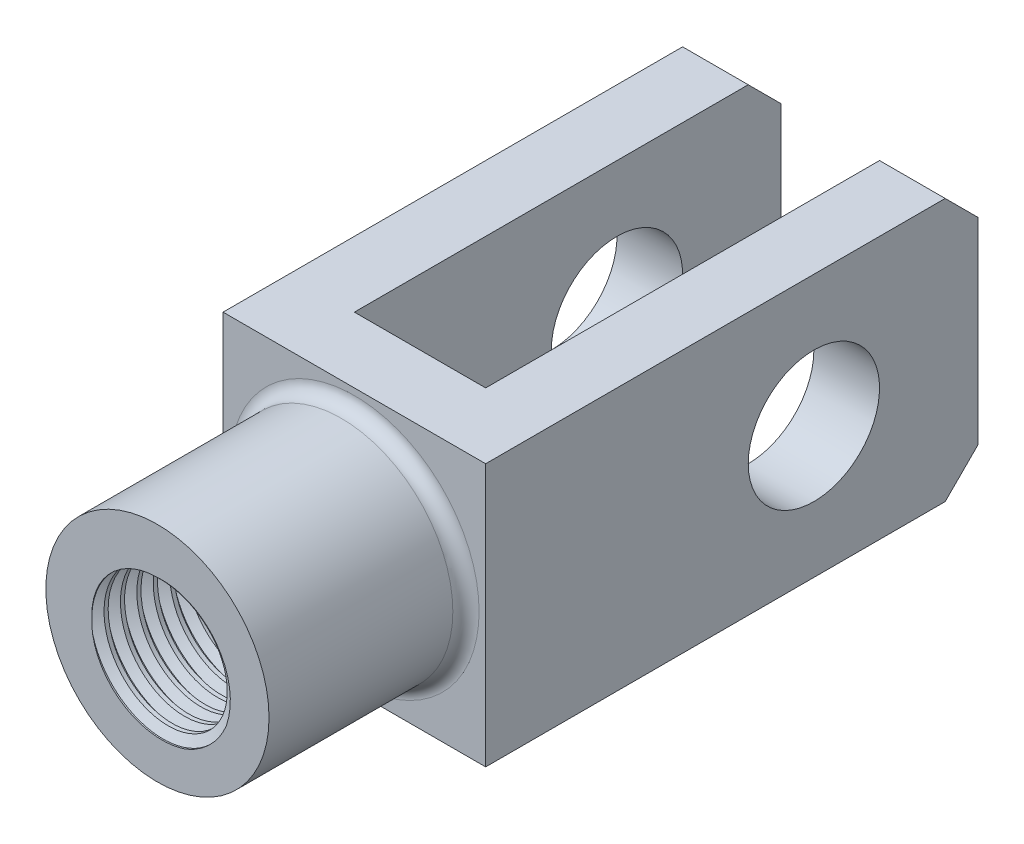
from build123d import *

# Parameters (mm, degrees)
SKETCH1_R           = 17
BOSS_EXTRUDE1_DEPTH = 30
SKETCH2_W           = 40
SKETCH2_H           = 40
BOSS_EXTRUDE2_DEPTH = 75
SKETCH3_W           = 20
SKETCH3_H           = 65
CUT_EXTRUDE1_DEPTH  = 75
CHAMFER1_SIZE       = 5
SKETCH4_R           = 10
CUT_EXTRUDE2_DEPTH  = 88.321245983
FILLET1_R           = 2
SKETCH7_R           = 10
CUT_EXTRUDE3_DEPTH  = 23
THREAD1_PITCH       = 2.5
THREAD1_TO          = 25.5


with BuildPart() as part:
    # Sketch1 → Boss-Extrude1 (new body)
    with BuildSketch(Plane.XY):
        Circle(SKETCH1_R)
    extrude(amount=BOSS_EXTRUDE1_DEPTH)

    # Sketch2 → Boss-Extrude2 (add)
    with BuildSketch(Plane(origin=(0, 0, 0), x_dir=(-1, 0, 0), z_dir=(0, 0, -1))):
        Rectangle(SKETCH2_W, SKETCH2_H)
    extrude(amount=BOSS_EXTRUDE2_DEPTH)

    # Sketch3 → Cut-Extrude1 (cut)
    with BuildSketch(Plane(origin=(0, 20, 0), x_dir=(1, 0, 0), z_dir=(0, 1, 0))):
        with Locations((0, 42.5)):
            Rectangle(SKETCH3_W, SKETCH3_H)
    extrude(amount=-CUT_EXTRUDE1_DEPTH, mode=Mode.SUBTRACT)

    # Chamfer1
    chamfer1_edges = [part.edges().sort_by_distance(p)[0] for p in [
        (15, 20, -75),
        (-15, -20, -75),
        (-15, 20, -75),
        (15, -20, -75),
    ]]
    chamfer(chamfer1_edges, length=CHAMFER1_SIZE)

    # Sketch4 → Cut-Extrude2 (cut, through all)
    with BuildSketch(Plane.ZY.offset(20)):
        with Locations((-50, 0)):
            Circle(SKETCH4_R)
    extrude(amount=-CUT_EXTRUDE2_DEPTH, mode=Mode.SUBTRACT)

    # Fillet1
    fillet1_edges = [part.edges().sort_by_distance(p)[0] for p in [
        (-17, 0, 0),
    ]]
    fillet(fillet1_edges, radius=FILLET1_R)

    # Sketch7 → Cut-Extrude3 (cut)
    with BuildSketch(Plane.XY.offset(30)):
        Circle(SKETCH7_R)
    extrude(amount=-CUT_EXTRUDE3_DEPTH, mode=Mode.SUBTRACT)

    # Thread1: arcs per turn and ends read off the stored shape
    # Thread1: the profile of Thread Profile1 profile screwed along a right-hand helix through 10.2 turns, 10 arcs to a turn; built about Z, then put on its axis
    thread1_z = Axis((0, 0, 0), (0, 0, 1))
    thread1_corners = [(9.9997, 0, -0.000173205), (11.353164687, 0, 0.781249997), (11.353164687, 0, 1.093749997), (9.9997, 0, 1.875173198)]
    with BuildLine(mode=Mode.PRIVATE) as thread1_profile:
        Line(thread1_corners[0], thread1_corners[1])
        Line(thread1_corners[1], thread1_corners[2])
        Line(thread1_corners[2], thread1_corners[3])
        Line(thread1_corners[3], thread1_corners[0])
    thread1_cap = Face(thread1_profile.wire())
    thread1_turn_angles = [0, 18, 36, 54, 72, 90, 108, 126, 144, 162, 180, 198, 216, 234, 252, 270, 288, 306, 324, 342, 360]
    thread1_turn_weights = [1, 0.9510565162951535, 1, 0.9510565162951535, 1, 0.9510565162951535, 1, 0.9510565162951535, 1, 0.9510565162951535, 1, 0.9510565162951535, 1, 0.9510565162951535, 1, 0.9510565162951535, 1, 0.9510565162951535, 1, 0.9510565162951535, 1]
    thread1_turn_rails = [Edge.make_bspline([Vector(p[0], p[1], 0).rotate(thread1_z, thread1_turn_angles[k]) / thread1_turn_weights[k] + Vector(0, 0, p[2] + THREAD1_PITCH * thread1_turn_angles[k] / 360) for k in range(21)], [0, 0, 0, 1, 1, 2, 2, 3, 3, 4, 4, 5, 5, 6, 6, 7, 7, 8, 8, 9, 9, 10, 10, 10], 2, thread1_turn_weights) for p in thread1_corners]
    thread1_turn_sides = [Face.make_surface_from_curves(thread1_turn_rails[p[0]], thread1_turn_rails[p[1]]) for p in [(0, 1), (1, 2), (2, 3), (3, 0)]]
    thread1_last_angles = [3600, 3618, 3636, 3654, 3672]
    thread1_last_weights = [1, 0.9510565162951535, 1, 0.9510565162951535, 1]
    thread1_last_rails = [Edge.make_bspline([Vector(p[0], p[1], 0).rotate(thread1_z, thread1_last_angles[k]) / thread1_last_weights[k] + Vector(0, 0, p[2] + THREAD1_PITCH * thread1_last_angles[k] / 360) for k in range(5)], [0, 0, 0, 1, 1, 2, 2, 2], 2, thread1_last_weights) for p in thread1_corners]
    thread1_last_sides = [Face.make_surface_from_curves(thread1_last_rails[p[0]], thread1_last_rails[p[1]]) for p in [(0, 1), (1, 2), (2, 3), (3, 0)]]
    thread1 = Plane(origin=(0, 0, 32.5), x_dir=(-1, 0, 0), z_dir=(0, 0, -1)) * split(Solid(Shell([*[p.moved(Location((0, 0, THREAD1_PITCH * i))) for i in range(10) for p in thread1_turn_sides], *thread1_last_sides, thread1_cap, thread1_cap.rotate(thread1_z, 3672).moved(Location((0, 0, THREAD1_PITCH * 3672 / 360)))])), bisect_by=Plane.XY.offset(THREAD1_TO), keep=Keep.BOTTOM, mode=Mode.PRIVATE)
    add(thread1, mode=Mode.SUBTRACT)


solid = part.part
